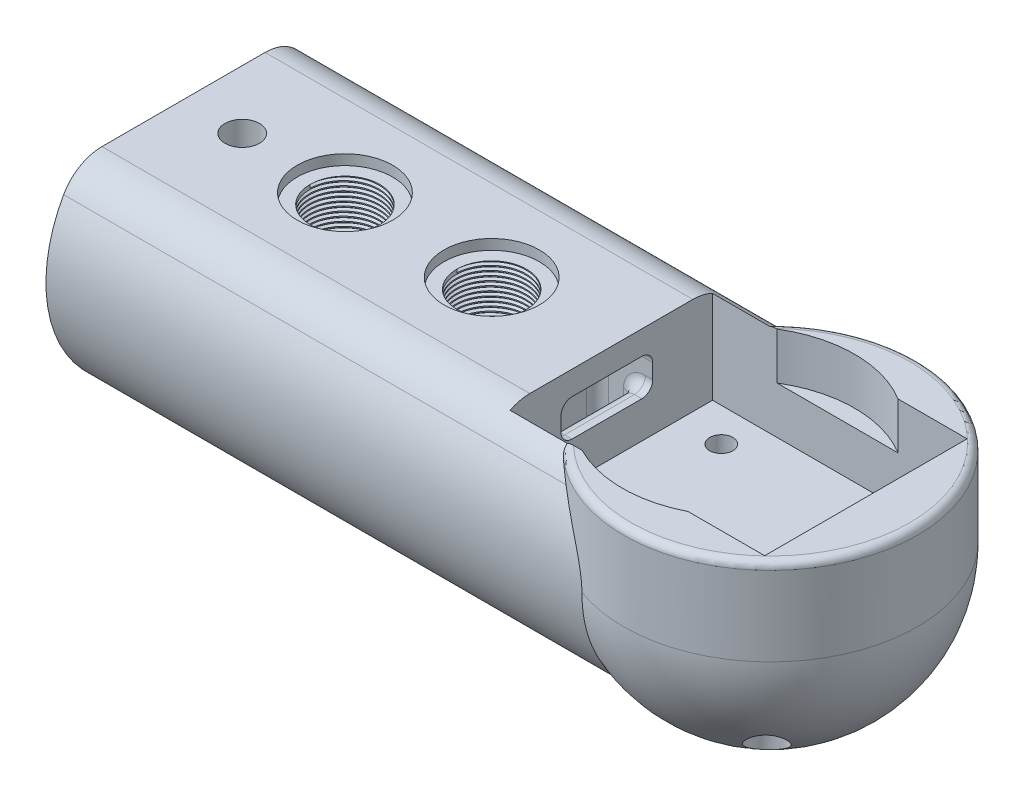
from build123d import *
from build123d.topology import SkipClean

# Parameters (mm, degrees)
SKETCH1_R           = 18.75
BOSS_EXTRUDE1_DEPTH = 80
SKETCH2_R           = 3
CUT_EXTRUDE1_DEPTH  = 12
SKETCH3_R           = 5.9
CUT_EXTRUDE3_DEPTH  = 3
REVOLVE95_ANGLE     = 180
SKETCH23_W          = 85
SKETCH23_H          = 37.5
CUT_EXTRUDE14_DEPTH = 6.5
SKETCH26_R          = 20
BOSS_EXTRUDE8_DEPTH = 12.5
FILLET9_R           = 6
SKETCH28_W          = 34.7
SKETCH28_H          = 27.6
CUT_EXTRUDE16_DEPTH = 13.5
SKETCH29_R          = 1.575
CUT_EXTRUDE17_DEPTH = 13.5
SKETCH35_R          = 6.5
CUT_EXTRUDE19_DEPTH = 1.4
SKETCH36_R          = 4.75
CUT_EXTRUDE20_DEPTH = 9.6
SKETCH37_R          = 4
CUT_EXTRUDE21_DEPTH = 22.6
SKETCH31_W          = 12.5
SKETCH31_H          = 5
CUT_EXTRUDE22_DEPTH = 7.5
SKETCH43_W          = 5
SKETCH43_H          = 12.5
CUT_EXTRUDE23_DEPTH = 16
SKETCH44_W          = 12.5
SKETCH44_H          = 5
CUT_EXTRUDE24_DEPTH = 45
SKETCH45_W          = 5
SKETCH45_H          = 12.5
CUT_EXTRUDE26_DEPTH = 30.44
FILLET10_R          = 1.5
THREAD1_PITCH       = 0.6
THREAD2_PITCH       = 0.6
SKETCH60_R          = 2.35
CUT_EXTRUDE28_DEPTH = 13
SKETCH61_R          = 2.35
CUT_EXTRUDE32_DEPTH = 10
CUT_EXTRUDE34_START = -0.7
SKETCH62_R          = 20
CUT_EXTRUDE34_DEPTH = 0.7
SKETCH63_R          = 15.83
CUT_EXTRUDE35_DEPTH = 7.07
FILLET11_R          = 1


with BuildPart() as part:
    # Sketch1 → Boss-Extrude1 (new body)
    with BuildSketch(Plane(origin=(0, 0, 0), x_dir=(0, 0, -1), z_dir=(1, 0, 0))):
        Circle(SKETCH1_R)
    extrude(amount=BOSS_EXTRUDE1_DEPTH)

    # Sketch2 → Cut-Extrude1 (cut)
    with BuildSketch(Plane(origin=(0, 0, 0), x_dir=(0, 0, -1), z_dir=(1, 0, 0))):
        Circle(SKETCH2_R)
    extrude(amount=CUT_EXTRUDE1_DEPTH, mode=Mode.SUBTRACT)

    # Sketch3 → Cut-Extrude3 (cut)
    with BuildSketch(Plane(origin=(0, 0, 0), x_dir=(0, 0, -1), z_dir=(1, 0, 0))):
        Circle(SKETCH3_R)
    extrude(amount=CUT_EXTRUDE3_DEPTH, mode=Mode.SUBTRACT)

    # Sketch5 → Revolve95 (revolve)
    with BuildSketch(Plane(origin=(0, 0, 0), x_dir=(1, 0, 0), z_dir=(0, 1, 0))):
        with BuildLine():
            Line((80, 20), (80, -20))
            ThreePointArc((80, -20), (100, 0), (80, 20))
        make_face()
    revolve(axis=Axis((80, 0, 0), (0, 0, -1)), revolution_arc=REVOLVE95_ANGLE)

    # Sketch23 → Cut-Extrude14 (cut)
    with BuildSketch(Plane(origin=(0, 18.75, 0), x_dir=(1, 0, 0), z_dir=(0, 1, 0))):
        with Locations((42.5, 0)):
            Rectangle(SKETCH23_W, SKETCH23_H)
    extrude(amount=-CUT_EXTRUDE14_DEPTH, mode=Mode.SUBTRACT)

    # Sketch26 → Boss-Extrude8 (add)
    with BuildSketch(Plane(origin=(0, 0, 0), x_dir=(1, 0, 0), z_dir=(0, 1, 0))):
        with Locations(Location((80, 0, 0), (0, 0, 270))):
            Circle(SKETCH26_R)
    extrude(amount=BOSS_EXTRUDE8_DEPTH)

    # Fillet9
    fillet9_edges = [part.edges().sort_by_distance(p)[0] for p in [
        (32.955499, 12.25, 14.19507),
        (32.955499, 12.25, -14.19507),
    ]]
    fillet(fillet9_edges, radius=FILLET9_R)

    # Sketch28 → Cut-Extrude16 (cut)
    with BuildSketch(Plane(origin=(0, 12.5, 0), x_dir=(1, 0, 0), z_dir=(0, 1, 0))):
        with Locations((75.65, 0)):
            Rectangle(SKETCH28_W, SKETCH28_H)
    extrude(amount=-CUT_EXTRUDE16_DEPTH, mode=Mode.SUBTRACT)

    # Sketch29 → Cut-Extrude17 (cut)
    with BuildSketch(Plane(origin=(0, -1, 0), x_dir=(1, 0, 0), z_dir=(0, 1, 0))):
        with Locations(Location((89.92, 9.22, 0), (0, 0, 180))):
            Circle(SKETCH29_R)
        with Locations(Location((89.92, -10.43, 0), (0, 0, 197.500399))):
            Circle(SKETCH29_R)
        with Locations(Location((64.07, -10.43, 0), (0, 0, 247.727638))):
            Circle(SKETCH29_R)
        with Locations(Location((64.07, 9.22, 0), (0, 0, 180))):
            Circle(SKETCH29_R)
    extrude(amount=-CUT_EXTRUDE17_DEPTH, mode=Mode.SUBTRACT)

    # Sketch35 → Cut-Extrude19 (cut)
    with BuildSketch(Plane(origin=(0, 12.25, 0), x_dir=(1, 0, 0), z_dir=(0, 1, 0))):
        with Locations(Location((22, 0, 0), (0, 0, 270))):
            Circle(SKETCH35_R)
        with Locations(Location((42, 0, 0), (0, 0, 90))):
            Circle(SKETCH35_R)
    extrude(amount=-CUT_EXTRUDE19_DEPTH, mode=Mode.SUBTRACT)

    # Sketch36 → Cut-Extrude20 (cut)
    with BuildSketch(Plane(origin=(0, 12.25, 0), x_dir=(1, 0, 0), z_dir=(0, 1, 0))):
        with Locations(Location((22, 0, 0), (0, 0, 270))):
            Circle(SKETCH36_R)
        with Locations(Location((42, 0, 0), (0, 0, 270))):
            Circle(SKETCH36_R)
    extrude(amount=-CUT_EXTRUDE20_DEPTH, mode=Mode.SUBTRACT)

    # Sketch37 → Cut-Extrude21 (cut)
    with BuildSketch(Plane(origin=(0, 12.25, 0), x_dir=(1, 0, 0), z_dir=(0, 1, 0))):
        with Locations(Location((22, 0, 0), (0, 0, 270))):
            Circle(SKETCH37_R)
        with Locations(Location((42, 0, 0), (0, 0, 270))):
            Circle(SKETCH37_R)
    extrude(amount=-CUT_EXTRUDE21_DEPTH, mode=Mode.SUBTRACT)

    # Sketch31 → Cut-Extrude22 (cut)
    with BuildSketch(Plane(origin=(58.3, 0, 0), x_dir=(0, 0, -1), z_dir=(1, 0, 0))):
        with Locations((-0.6, 6.5)):
            Rectangle(SKETCH31_W, SKETCH31_H)
    extrude(amount=-CUT_EXTRUDE22_DEPTH, mode=Mode.SUBTRACT)

    # Sketch43 → Cut-Extrude23 (cut)
    with BuildSketch(Plane(origin=(0, 4, 0), x_dir=(1, 0, 0), z_dir=(0, 1, 0))):
        with Locations((53.3, -0.6)):
            Rectangle(SKETCH43_W, SKETCH43_H)
    extrude(amount=-CUT_EXTRUDE23_DEPTH, mode=Mode.SUBTRACT)

    # Sketch44 → Cut-Extrude24 (cut)
    with BuildSketch(Plane(origin=(50.8, 0, 0), x_dir=(0, 0, -1), z_dir=(1, 0, 0))):
        with Locations((-0.6, -9.5)):
            Rectangle(SKETCH44_W, SKETCH44_H)
    extrude(amount=-CUT_EXTRUDE24_DEPTH, mode=Mode.SUBTRACT)

    # Sketch45 → Cut-Extrude26 (cut)
    with BuildSketch(Plane(origin=(0, -12, 0), x_dir=(1, 0, 0), z_dir=(0, 1, 0))):
        with Locations((8.3, -0.6)):
            Rectangle(SKETCH45_W, SKETCH45_H)
    extrude(amount=-CUT_EXTRUDE26_DEPTH, mode=Mode.SUBTRACT)

    # Fillet10
    fillet10_edges = [part.edges().sort_by_distance(p)[0] for p in [
        (50.8, 1, 6.85),
        (50.8, 9, 0.6),
        (54.55, 9, 6.85),
        (54.55, 9, -5.65),
        (57.05, 4, -5.65),
        (57.05, 4, 6.85),
        (33.3, -12, -5.65),
        (55.8, -12, 0.6),
        (55.8, -4, -5.65),
        (55.8, -4, 6.85),
        (55.8, 4, 0.6),
        (50.8, 1, -5.65),
        (5.8, -7, 0.6),
        (28.3, -7, 6.85),
        (5.8, -12.22697, 6.85),
        (5.8, -12.439239, -5.65),
        (28.3, -7, -5.65),
        (50.8, -7, 0.6),
        (33.3, -12, 6.85),
        (10.8, -14.939239, -5.65),
        (10.8, -14.72697, 6.85),
        (10.8, -12, 0.6),
    ]]
    fillet(fillet10_edges, radius=FILLET10_R)

    # Thread1: arcs per turn and ends read off the stored shape
    # Thread1: the profile of Thread Profile1 profile screwed along a right-hand helix through 13.333333 turns, 6 arcs to a turn; built about Z, then put on its axis
    with SkipClean():  # the faces are left unmerged after this step: merging them gives an invalid solid
        thread1_z = Axis((0, 0, 0), (0, 0, 1))
        thread1_corners = [(4.7497, 0, -0.000173), (5.07476, 0, 0.1875), (5.07476, 0, 0.2625), (4.7497, 0, 0.450173)]
        with BuildLine(mode=Mode.PRIVATE) as thread1_profile:
            Line(thread1_corners[0], thread1_corners[1])
            Line(thread1_corners[1], thread1_corners[2])
            Line(thread1_corners[2], thread1_corners[3])
            Line(thread1_corners[3], thread1_corners[0])
        thread1_cap = Face(thread1_profile.wire())
        thread1_turn_angles = [0, 30, 60, 90, 120, 150, 180, 210, 240, 270, 300, 330, 360]
        thread1_turn_weights = [1, 0.8660254037844387, 1, 0.8660254037844387, 1, 0.8660254037844387, 1, 0.8660254037844387, 1, 0.8660254037844387, 1, 0.8660254037844387, 1]
        thread1_turn_rails = [Edge.make_bspline([Vector(p[0], p[1], 0).rotate(thread1_z, thread1_turn_angles[k]) / thread1_turn_weights[k] + Vector(0, 0, p[2] + THREAD1_PITCH * thread1_turn_angles[k] / 360) for k in range(13)], [0, 0, 0, 1, 1, 2, 2, 3, 3, 4, 4, 5, 5, 6, 6, 6], 2, thread1_turn_weights) for p in thread1_corners]
        thread1_turn_sides = [Face.make_surface_from_curves(thread1_turn_rails[p[0]], thread1_turn_rails[p[1]]) for p in [(0, 1), (1, 2), (2, 3), (3, 0)]]
        thread1_last_angles = [4680, 4710, 4740, 4770, 4800]
        thread1_last_weights = [1, 0.8660254037844387, 1, 0.8660254037844387, 1]
        thread1_last_rails = [Edge.make_bspline([Vector(p[0], p[1], 0).rotate(thread1_z, thread1_last_angles[k]) / thread1_last_weights[k] + Vector(0, 0, p[2] + THREAD1_PITCH * thread1_last_angles[k] / 360) for k in range(5)], [0, 0, 0, 1, 1, 2, 2, 2], 2, thread1_last_weights) for p in thread1_corners]
        thread1_last_sides = [Face.make_surface_from_curves(thread1_last_rails[p[0]], thread1_last_rails[p[1]]) for p in [(0, 1), (1, 2), (2, 3), (3, 0)]]
        thread1 = Plane(origin=(22, 10.85, 0), x_dir=(-1, 0, 0), z_dir=(0, -1, 0)) * Solid(Shell([*[p.moved(Location((0, 0, THREAD1_PITCH * i))) for i in range(13) for p in thread1_turn_sides], *thread1_last_sides, thread1_cap, thread1_cap.rotate(thread1_z, 4800).moved(Location((0, 0, THREAD1_PITCH * 4800 / 360)))]))
        add(thread1, mode=Mode.SUBTRACT)

    # Thread2: arcs per turn and ends read off the stored shape
    # Thread2: the profile of Thread Profile2 profile screwed along a right-hand helix through 13.333333 turns, 6 arcs to a turn; built about Z, then put on its axis
    with SkipClean():  # the faces are left unmerged after this step: merging them gives an invalid solid
        thread2_z = Axis((0, 0, 0), (0, 0, 1))
        thread2_corners = [(4.7497, 0, -0.000173), (5.07476, 0, 0.1875), (5.07476, 0, 0.2625), (4.7497, 0, 0.450173)]
        with BuildLine(mode=Mode.PRIVATE) as thread2_profile:
            Line(thread2_corners[0], thread2_corners[1])
            Line(thread2_corners[1], thread2_corners[2])
            Line(thread2_corners[2], thread2_corners[3])
            Line(thread2_corners[3], thread2_corners[0])
        thread2_cap = Face(thread2_profile.wire())
        thread2_turn_angles = [0, 30, 60, 90, 120, 150, 180, 210, 240, 270, 300, 330, 360]
        thread2_turn_weights = [1, 0.8660254037844387, 1, 0.8660254037844387, 1, 0.8660254037844387, 1, 0.8660254037844387, 1, 0.8660254037844387, 1, 0.8660254037844387, 1]
        thread2_turn_rails = [Edge.make_bspline([Vector(p[0], p[1], 0).rotate(thread2_z, thread2_turn_angles[k]) / thread2_turn_weights[k] + Vector(0, 0, p[2] + THREAD2_PITCH * thread2_turn_angles[k] / 360) for k in range(13)], [0, 0, 0, 1, 1, 2, 2, 3, 3, 4, 4, 5, 5, 6, 6, 6], 2, thread2_turn_weights) for p in thread2_corners]
        thread2_turn_sides = [Face.make_surface_from_curves(thread2_turn_rails[p[0]], thread2_turn_rails[p[1]]) for p in [(0, 1), (1, 2), (2, 3), (3, 0)]]
        thread2_last_angles = [4680, 4710, 4740, 4770, 4800]
        thread2_last_weights = [1, 0.8660254037844387, 1, 0.8660254037844387, 1]
        thread2_last_rails = [Edge.make_bspline([Vector(p[0], p[1], 0).rotate(thread2_z, thread2_last_angles[k]) / thread2_last_weights[k] + Vector(0, 0, p[2] + THREAD2_PITCH * thread2_last_angles[k] / 360) for k in range(5)], [0, 0, 0, 1, 1, 2, 2, 2], 2, thread2_last_weights) for p in thread2_corners]
        thread2_last_sides = [Face.make_surface_from_curves(thread2_last_rails[p[0]], thread2_last_rails[p[1]]) for p in [(0, 1), (1, 2), (2, 3), (3, 0)]]
        thread2 = Plane(origin=(42, 10.85, 0), x_dir=(-1, 0, 0), z_dir=(0, -1, 0)) * Solid(Shell([*[p.moved(Location((0, 0, THREAD2_PITCH * i))) for i in range(13) for p in thread2_turn_sides], *thread2_last_sides, thread2_cap, thread2_cap.rotate(thread2_z, 4800).moved(Location((0, 0, THREAD2_PITCH * 4800 / 360)))]))
        add(thread2, mode=Mode.SUBTRACT)

    # Sketch60 → Cut-Extrude28 (cut)
    with SkipClean():  # the faces are left unmerged after this step: merging them gives an invalid solid
        with BuildSketch(Plane(origin=(0, -20, 0), x_dir=(-1, 0, 0), z_dir=(0, -1, 0))):
            with Locations(Location((-89.92, 9.22, 0), (0, 0, 180))):
                Circle(SKETCH60_R)
            with Locations(Location((-89.92, -10.43, 0), (0, 0, 44.984263))):
                Circle(SKETCH60_R)
            with Locations(Location((-64.07, -10.43, 0), (0, 0, 180))):
                Circle(SKETCH60_R)
            with Locations(Location((-64.07, 9.22, 0), (0, 0, 180))):
                Circle(SKETCH60_R)
        extrude(amount=-CUT_EXTRUDE28_DEPTH, mode=Mode.SUBTRACT)

    # Sketch61 → Cut-Extrude32 (cut)
    with SkipClean():  # the faces are left unmerged after this step: merging them gives an invalid solid
        with BuildSketch(Plane(origin=(0, 12.25, 0), x_dir=(1, 0, 0), z_dir=(0, 1, 0))):
            with Locations(Location((8, 0, 0), (0, 0, 270))):
                Circle(SKETCH61_R)
        extrude(amount=-CUT_EXTRUDE32_DEPTH, mode=Mode.SUBTRACT)

    # Sketch62 → Cut-Extrude34 (cut)
    with SkipClean():  # the faces are left unmerged after this step: merging them gives an invalid solid
        with BuildSketch(Plane(origin=(0, 12.5, 0), x_dir=(1, 0, 0), z_dir=(0, 1, 0)).offset(CUT_EXTRUDE34_START)):
            with Locations((80, 0)):
                Circle(SKETCH62_R)
        extrude(amount=CUT_EXTRUDE34_DEPTH, mode=Mode.SUBTRACT)

    # Sketch63 → Cut-Extrude35 (cut)
    with SkipClean():  # the faces are left unmerged after this step: merging them gives an invalid solid
        with BuildSketch(Plane(origin=(0, 12.5, 0), x_dir=(1, 0, 0), z_dir=(0, 1, 0))):
            with Locations((75.34, 0.29)):
                Circle(SKETCH63_R)
        extrude(amount=-CUT_EXTRUDE35_DEPTH, mode=Mode.SUBTRACT)

    # Fillet11
    fillet11_edges = [part.edges().sort_by_distance(p)[0] for p in [
        (87.432236, 11.8, 18.567764),
    ]]
    fillet(fillet11_edges, radius=FILLET11_R)


solid = part.part
